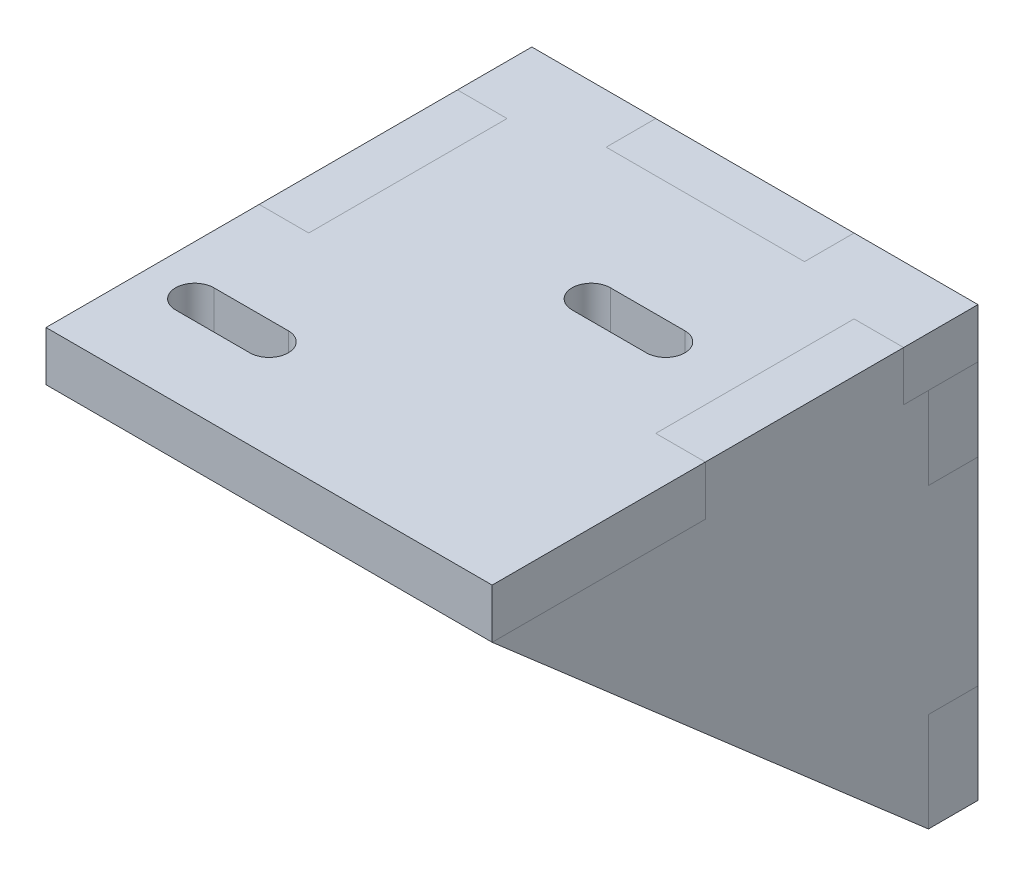
from build123d import *

# Parameters (mm, degrees)
SKETCH1_W                 = 57.15
SKETCH1_H                 = 54.999999982
BOSS_EXTRUDE1_DEPTH       = 3.175
SKETCH2_W                 = 57.15
SKETCH2_H                 = 6.35
BOSS_EXTRUDE2_DEPTH       = 55.88
M5_CLEARANCE_HOLE1_D      = 5.8
M5_CLEARANCE_HOLE1_DEPTH  = 6.35
M5_CLEARANCE_HOLE1_TIP    = 1.742495795
BOSS_EXTRUDE3_DEPTH       = 6.35
BOSS_EXTRUDE4_START       = -57.15
BOSS_EXTRUDE4_DEPTH       = 6.35
F_8_CLEARANCE_HOLE1_D     = 4.9149
F_8_CLEARANCE_HOLE1_DEPTH = 6.35
F_8_CLEARANCE_HOLE1_TIP   = 1.476584928
CUT_EXTRUDE1_START        = -50
CUT_EXTRUDE1_DEPTH        = 50
SKETCH9_R                 = 5.08
CUT_EXTRUDE2_DEPTH        = 82.675248076
SPLIT2_START              = 3.175
SPLIT2_OUTLINE_W          = 6.35
SPLIT2_OUTLINE_H          = 50.149999991
SPLIT2_DEPTH              = 56.825
SPLIT2_START_2            = 22.225
SPLIT2_2_DEPTH            = 6.35
SPLIT2_START_3            = -28.575
SPLIT2_3_DEPTH            = 1.27
SPLIT2_START_4            = -27.305
SPLIT2_4_DEPTH            = 5.08
SPLIT2_START_5            = -27.499999991
SPLIT2_5_DEPTH            = 48.649999982
SKETCH10_W                = 25.4
SKETCH10_H                = 6.35
CUT_EXTRUDE4_DEPTH        = 86.609717019
SKETCH11_W                = 6.35
SKETCH11_H                = 25.4
CUT_EXTRUDE5_DEPTH        = 86.609717019
SKETCH12_W                = 25.4
SKETCH12_H                = 6.35
BOSS_EXTRUDE5_DEPTH       = 6.35
SKETCH13_W                = 6.35
SKETCH13_H                = 25.4
BOSS_EXTRUDE6_DEPTH       = 6.35
SKETCH14_W                = 6.35
SKETCH14_H                = 25.4
BOSS_EXTRUDE7_DEPTH       = 6.35
SKETCH15_W                = 6.35
SKETCH15_H                = 25.4
CUT_EXTRUDE6_DEPTH        = 74.792638688
SKETCH16_W                = 6.35
SKETCH16_H                = 25.4
BOSS_EXTRUDE8_DEPTH       = 6.35
SKETCH17_W                = 6.35
SKETCH17_H                = 25.4
BOSS_EXTRUDE9_DEPTH       = 6.35


with BuildPart() as part:
    # Sketch1 → Boss-Extrude1 (new, symmetric)
    with BuildSketch(Plane.XY):
        Rectangle(SKETCH1_W, SKETCH1_H)
    extrude(amount=BOSS_EXTRUDE1_DEPTH, both=True)

    # Sketch2 → Boss-Extrude2 (add)
    with BuildSketch(Plane.XY.offset(3.175)):
        with Locations((0, 24.324999991)):
            Rectangle(SKETCH2_W, SKETCH2_H)
    extrude(amount=BOSS_EXTRUDE2_DEPTH)

    # M5 Clearance Hole1
    with Locations(Plane.XY.offset(3.175)):
        with Locations((0, 0.829999991)):
            Hole(M5_CLEARANCE_HOLE1_D / 2, depth=M5_CLEARANCE_HOLE1_DEPTH)
            with Locations((0, 0, -(M5_CLEARANCE_HOLE1_DEPTH + M5_CLEARANCE_HOLE1_TIP / 2))):  # 118° drill point
                Cone(0, M5_CLEARANCE_HOLE1_D / 2, M5_CLEARANCE_HOLE1_TIP, mode=Mode.SUBTRACT)

    # Sketch8 → Boss-Extrude3 (add)
    with BuildSketch(Plane(origin=(28.575, 0, 0), x_dir=(0, 0, -1), z_dir=(1, 0, 0))):
        Polygon((-59.055, 21.149999991), (-3.175, -27.499999991), (-3.175, 21.149999991), align=None)
    extrude(amount=-BOSS_EXTRUDE3_DEPTH)

    # Sketch8<2> → Boss-Extrude4 (add)
    with BuildSketch(Plane(origin=(28.575, 0, 0), x_dir=(0, 0, -1), z_dir=(1, 0, 0)).offset(BOSS_EXTRUDE4_START)):
        Polygon((-59.055, 21.149999991), (-3.175, -27.499999991), (-3.175, 21.149999991), align=None)
    extrude(amount=BOSS_EXTRUDE4_DEPTH)

    # #8 Clearance Hole1
    with Locations(Plane(origin=(0, 27.499999991, 0), x_dir=(1, 0, 0), z_dir=(0, 1, 0))):
        with Locations((-22.225, -46.355), (3.17116431, -20.95883569)):
            Hole(F_8_CLEARANCE_HOLE1_D / 2, depth=F_8_CLEARANCE_HOLE1_DEPTH)
            with Locations((0, 0, -(F_8_CLEARANCE_HOLE1_DEPTH + F_8_CLEARANCE_HOLE1_TIP / 2))):  # 118° drill point
                Cone(0, F_8_CLEARANCE_HOLE1_D / 2, F_8_CLEARANCE_HOLE1_TIP, mode=Mode.SUBTRACT)

    # Sketch7 → Cut-Extrude1 (cut)
    with BuildSketch(Plane(origin=(0, 27.499999991, 0), x_dir=(1, 0, 0), z_dir=(0, 1, 0)).offset(CUT_EXTRUDE1_START)):
        with BuildLine():
            Line((-22.225, -43.89755), (-12.7, -43.89755))
            ThreePointArc((-12.7, -43.89755), (-10.24255, -46.355), (-12.7, -48.81245))
            Line((-12.7, -48.81245), (-22.225, -48.81245))
            ThreePointArc((-22.225, -48.81245), (-24.68245, -46.355), (-22.225, -43.89755))
        make_face()
        with BuildLine():
            Line((3.17116431, -18.50138569), (12.69616431, -18.50138569))
            ThreePointArc((12.69616431, -18.50138569), (15.15361431, -20.95883569), (12.69616431, -23.41628569))
            Line((12.69616431, -23.41628569), (3.17116431, -23.41628569))
            ThreePointArc((3.17116431, -23.41628569), (0.71371431, -20.95883569), (3.17116431, -18.50138569))
        make_face()
    extrude(amount=CUT_EXTRUDE1_DEPTH, mode=Mode.SUBTRACT)

    # Sketch9 → Cut-Extrude2 (cut, through all)
    with BuildSketch(Plane.XZ.offset(-21.149999991)):
        with Locations((-22.225, 46.355)):
            Circle(SKETCH9_R)
    extrude(amount=CUT_EXTRUDE2_DEPTH, mode=Mode.SUBTRACT)


with BuildPart() as body_2:
    # Split1: read off the stored shape, not the designer's step
    # Split1: the piece on the far side of the plane
    add(part.part)
    split(bisect_by=Plane(origin=(0, 21.149999991, 0), x_dir=(1, 0, 0), z_dir=(0, 1, 0)), keep=Keep.BOTTOM)

    # Split2: read off the stored shape, not the designer's step
    # Split2 outline → Split2 (cut)
    with BuildSketch(Plane.XY.offset(SPLIT2_START)):
        with Locations((-25.4, -3.925000005)):
            Rectangle(SPLIT2_OUTLINE_W, SPLIT2_OUTLINE_H)
        with Locations((25.4, -3.925000005)):
            Rectangle(SPLIT2_OUTLINE_W, SPLIT2_OUTLINE_H)
    extrude(amount=SPLIT2_DEPTH, mode=Mode.SUBTRACT)

    # Sketch12 → Boss-Extrude5 (add)
    with BuildSketch(Plane(origin=(0, 21.149999991, 0), x_dir=(1, 0, 0), z_dir=(0, 1, 0))):
        Rectangle(SKETCH12_W, SKETCH12_H)
    extrude(amount=BOSS_EXTRUDE5_DEPTH)

    # Sketch15 → Cut-Extrude6 (cut, through all)
    with BuildSketch(Plane(origin=(0, 0, -3.175), x_dir=(-1, 0, 0), z_dir=(0, 0, -1))):
        with Locations((-25.4, -2.099999991)):
            Rectangle(SKETCH15_W, SKETCH15_H)
    cut_extrude6 = extrude(amount=-CUT_EXTRUDE6_DEPTH, mode=Mode.SUBTRACT)

    # Mirror2: Cut-Extrude6 across plane
    add(cut_extrude6.mirror(Plane(origin=(0, 0, 0), x_dir=(0, 0, 1), z_dir=(1, 0, 0))), mode=Mode.SUBTRACT)


with BuildPart() as part_1:
    add(part.part)

    # Split1
    split(bisect_by=Plane(origin=(0, 21.149999991, 0), x_dir=(1, 0, 0), z_dir=(0, 1, 0)), keep=Keep.TOP)

    # Sketch10 → Cut-Extrude4 (cut, through all)
    with BuildSketch(Plane(origin=(0, 27.499999991, 0), x_dir=(1, 0, 0), z_dir=(0, 1, 0))):
        Rectangle(SKETCH10_W, SKETCH10_H)
    extrude(amount=-CUT_EXTRUDE4_DEPTH, mode=Mode.SUBTRACT)

    # Sketch11 → Cut-Extrude5 (cut, through all)
    with BuildSketch(Plane(origin=(0, 27.499999991, 0), x_dir=(1, 0, 0), z_dir=(0, 1, 0))):
        with Locations((-25.4, -19.05)):
            Rectangle(SKETCH11_W, SKETCH11_H)
    cut_extrude5 = extrude(amount=-CUT_EXTRUDE5_DEPTH, mode=Mode.SUBTRACT)

    # Mirror1: Cut-Extrude5 across plane
    add(cut_extrude5.mirror(Plane(origin=(0, 0, 0), x_dir=(0, 0, 1), z_dir=(1, 0, 0))), mode=Mode.SUBTRACT)


with BuildPart() as body_3:
    # Split2 2 outline → Split2 2 (new body)
    with BuildSketch(Plane.YZ.offset(SPLIT2_START_2)):
        Polygon((-27.499999991, 3.175), (21.149999991, 3.175), (21.149999991, 59.055), align=None)
    extrude(amount=SPLIT2_2_DEPTH)

    # Sketch14 → Boss-Extrude7 (add)
    with BuildSketch(Plane(origin=(0, 21.149999991, 0), x_dir=(1, 0, 0), z_dir=(0, 1, 0))):
        with Locations((25.4, -19.05)):
            Rectangle(SKETCH14_W, SKETCH14_H)
    extrude(amount=BOSS_EXTRUDE7_DEPTH)

    # Sketch16 → Boss-Extrude8 (add)
    with BuildSketch(Plane(origin=(0, 0, 3.175), x_dir=(-1, 0, 0), z_dir=(0, 0, -1))):
        with Locations((-25.4, -2.099999991)):
            Rectangle(SKETCH16_W, SKETCH16_H)
    extrude(amount=BOSS_EXTRUDE8_DEPTH)


with BuildPart() as body_4:
    # Split2 3 outline → Split2 3 (new body)
    with BuildSketch(Plane.YZ.offset(SPLIT2_START_3)):
        Polygon((-27.499999991, 3.175), (21.149999991, 3.175), (21.149999991, 59.055), align=None)
    extrude(amount=SPLIT2_3_DEPTH)

    # Split2 4 outline → Split2 4 (add)
    with BuildSketch(Plane.YZ.offset(SPLIT2_START_4)):
        Polygon((-27.499999991, 3.175), (21.149999991, 3.175), (21.149999991, 59.055), align=None)
    extrude(amount=SPLIT2_4_DEPTH)

    # Split2 5 outline → Split2 5 (cut)
    with BuildSketch(Plane(origin=(0, 0, 0), x_dir=(1, 0, 0), z_dir=(0, 1, 0)).offset(SPLIT2_START_5)):
        with BuildLine():
            Line((-22.225, -51.435), (-22.225, -41.275))
            ThreePointArc((-22.225, -41.275), (-27.305, -46.355), (-22.225, -51.435))
        make_face()
    extrude(amount=SPLIT2_5_DEPTH, mode=Mode.SUBTRACT)

    # Sketch13 → Boss-Extrude6 (add)
    with BuildSketch(Plane(origin=(0, 21.149999991, 0), x_dir=(1, 0, 0), z_dir=(0, 1, 0))):
        with Locations((-25.4, -19.05)):
            Rectangle(SKETCH13_W, SKETCH13_H)
    extrude(amount=BOSS_EXTRUDE6_DEPTH)

    # Sketch17 → Boss-Extrude9 (add)
    with BuildSketch(Plane(origin=(0, 0, 3.175), x_dir=(-1, 0, 0), z_dir=(0, 0, -1))):
        with Locations((25.4, -2.099999991)):
            Rectangle(SKETCH17_W, SKETCH17_H)
    extrude(amount=BOSS_EXTRUDE9_DEPTH)


solid = Compound([body_2.part, part_1.part, body_3.part, body_4.part])
